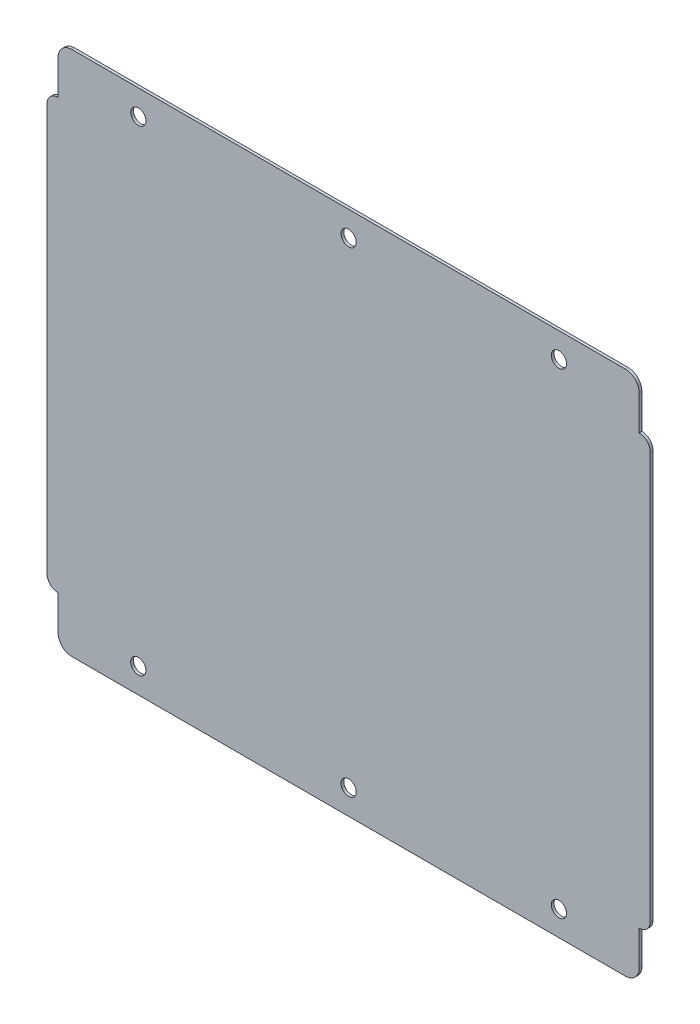
from build123d import *

# Parameters (mm, degrees)
EXTRUDE_1_DEPTH     = 1
FILLET_1_R          = 10
FILLET_2_R          = 8
SKETCH_2_R          = 5.5
CUT_EXTRUDE_1_DEPTH = 10


with BuildPart() as part:
    # Эскиз1 → Бобышка-Вытянуть1 (new, symmetric)
    with BuildSketch(Plane.XY):
        Polygon((-210, 155), (-210, 190), (210, 190), (210, 155), (218, 155), (218, -155), (210, -155), (210, -190), (-210, -190), (-210, -155), (-218, -155), (-218, 155), align=None)
    extrude(amount=EXTRUDE_1_DEPTH, both=True)

    # Скругление1
    fillet_1_edges = [part.edges().sort_by_distance(p)[0] for p in [
        (210, -190, 0),
        (-210, -190, 0),
        (-210, 190, 0),
        (210, 190, 0),
    ]]
    fillet(fillet_1_edges, radius=FILLET_1_R)

    # Скругление2
    fillet_2_edges = [part.edges().sort_by_distance(p)[0] for p in [
        (-218, -155, 0),
        (-218, 155, 0),
        (218, 155, 0),
        (218, -155, 0),
    ]]
    fillet(fillet_2_edges, radius=FILLET_2_R - 0.0001)  # a hair under: the kernel refuses the full size

    # Эскиз2 → Вырез-Вытянуть1 (cut)
    with BuildSketch(Plane.XY.offset(1)):
        with Locations((0, -172)):
            Circle(SKETCH_2_R)
        with Locations((152, -172)):
            Circle(SKETCH_2_R)
        with Locations((-152, -172)):
            Circle(SKETCH_2_R)
        with Locations((-152, 172)):
            Circle(SKETCH_2_R)
        with Locations((152, 172)):
            Circle(SKETCH_2_R)
        with Locations((0, 172)):
            Circle(SKETCH_2_R)
    extrude(amount=-CUT_EXTRUDE_1_DEPTH, mode=Mode.SUBTRACT)


solid = part.part
